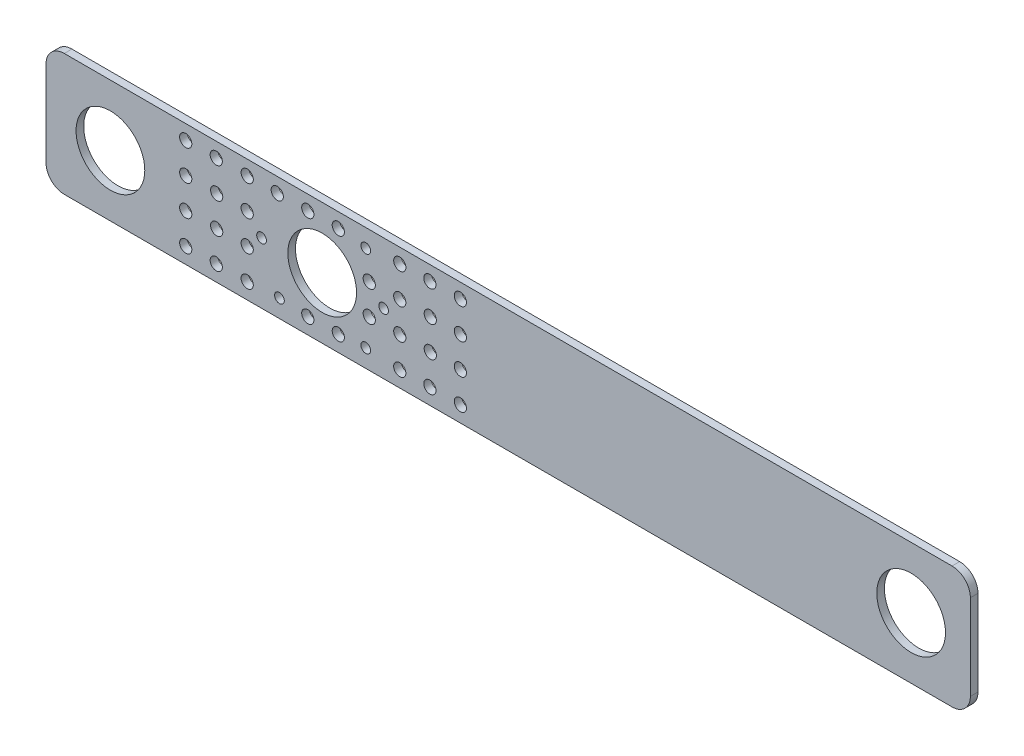
from build123d import *

# Parameters (mm, degrees)
SKETCH1_W           = 384.714130078
SKETCH1_H           = 50.8
SKETCH1_R           = 14.3002
SKETCH1_R_2         = 2.0193
SKETCH1_R_3         = 2.54
BOSS_EXTRUDE1_DEPTH = 3.175
FILLET1_R           = 7.62


with BuildPart() as part:
    # Sketch1 → Boss-Extrude1 (new body)
    with BuildSketch(Plane.XY):
        with Locations((91.437616825, 0.672961839)):
            Rectangle(SKETCH1_W, SKETCH1_H)
        with Locations((-74.109858368, 0.672961839)):
            Circle(SKETCH1_R, mode=Mode.SUBTRACT)
        with Locations((14.028141632, 0.672961839)):
            Circle(SKETCH1_R, mode=Mode.SUBTRACT)
        with Locations((259.138141632, 0.672961839)):
            Circle(SKETCH1_R, mode=Mode.SUBTRACT)
        with Locations((39.592109109, 0.662961839)):
            Circle(SKETCH1_R_2, mode=Mode.SUBTRACT)
        with Locations((32.152621351, -17.297550403)):
            Circle(SKETCH1_R_2, mode=Mode.SUBTRACT)
        with Locations((-3.768403133, -17.297550403)):
            Circle(SKETCH1_R_2, mode=Mode.SUBTRACT)
        with Locations((32.152621351, 18.623474081)):
            Circle(SKETCH1_R_2, mode=Mode.SUBTRACT)
        with Locations((-11.207890891, 0.662961839)):
            Circle(SKETCH1_R_2, mode=Mode.SUBTRACT)
        with Locations((-29.885519869, 7.289574438)):
            Circle(SKETCH1_R_3, mode=Mode.SUBTRACT)
        with Locations((-29.885519869, -5.410425562)):
            Circle(SKETCH1_R_3, mode=Mode.SUBTRACT)
        with Locations((-17.185519869, 7.289574438)):
            Circle(SKETCH1_R_3, mode=Mode.SUBTRACT)
        with Locations((-17.185519869, -5.410425562)):
            Circle(SKETCH1_R_3, mode=Mode.SUBTRACT)
        with Locations((-17.185519869, -18.110425562)):
            Circle(SKETCH1_R_3, mode=Mode.SUBTRACT)
        with Locations((-17.185519869, 19.989574438)):
            Circle(SKETCH1_R_3, mode=Mode.SUBTRACT)
        with Locations((-30.066807854, 19.989574438)):
            Circle(SKETCH1_R_3, mode=Mode.SUBTRACT)
        with Locations((33.614480131, -5.410425562)):
            Circle(SKETCH1_R_3, mode=Mode.SUBTRACT)
        with Locations((33.614480131, 7.289574438)):
            Circle(SKETCH1_R_3, mode=Mode.SUBTRACT)
        with Locations((59.014480131, -5.410425562)):
            Circle(SKETCH1_R_3, mode=Mode.SUBTRACT)
        with Locations((59.014480131, 7.289574438)):
            Circle(SKETCH1_R_3, mode=Mode.SUBTRACT)
        with Locations((46.314480131, 7.289574438)):
            Circle(SKETCH1_R_3, mode=Mode.SUBTRACT)
        with Locations((46.314480131, -5.410425562)):
            Circle(SKETCH1_R_3, mode=Mode.SUBTRACT)
        with Locations((46.314480131, -18.110425562)):
            Circle(SKETCH1_R_3, mode=Mode.SUBTRACT)
        with Locations((58.833192146, -18.110425562)):
            Circle(SKETCH1_R_3, mode=Mode.SUBTRACT)
        with Locations((71.533192146, -18.110425562)):
            Circle(SKETCH1_R_3, mode=Mode.SUBTRACT)
        with Locations((71.533192146, -5.410425562)):
            Circle(SKETCH1_R_3, mode=Mode.SUBTRACT)
        with Locations((71.533192146, 7.289574438)):
            Circle(SKETCH1_R_3, mode=Mode.SUBTRACT)
        with Locations((71.533192146, 19.989574438)):
            Circle(SKETCH1_R_3, mode=Mode.SUBTRACT)
        with Locations((58.833192146, 19.989574438)):
            Circle(SKETCH1_R_3, mode=Mode.SUBTRACT)
        with Locations((46.314480131, 19.989574438)):
            Circle(SKETCH1_R_3, mode=Mode.SUBTRACT)
        with Locations((20.733192146, 19.989574438)):
            Circle(SKETCH1_R_3, mode=Mode.SUBTRACT)
        with Locations((8.033192146, 19.989574438)):
            Circle(SKETCH1_R_3, mode=Mode.SUBTRACT)
        with Locations((-4.666807854, 19.989574438)):
            Circle(SKETCH1_R_3, mode=Mode.SUBTRACT)
        with Locations((20.733192146, -18.110425562)):
            Circle(SKETCH1_R_3, mode=Mode.SUBTRACT)
        with Locations((8.033192146, -18.110425562)):
            Circle(SKETCH1_R_3, mode=Mode.SUBTRACT)
        with Locations((-30.066807854, -18.110425562)):
            Circle(SKETCH1_R_3, mode=Mode.SUBTRACT)
        with Locations((-42.766807854, -18.110425562)):
            Circle(SKETCH1_R_3, mode=Mode.SUBTRACT)
        with Locations((-42.766807854, 19.989574438)):
            Circle(SKETCH1_R_3, mode=Mode.SUBTRACT)
        with Locations((-42.766807854, 7.289574438)):
            Circle(SKETCH1_R_3, mode=Mode.SUBTRACT)
        with Locations((-42.766807854, -5.410425562)):
            Circle(SKETCH1_R_3, mode=Mode.SUBTRACT)
    extrude(amount=BOSS_EXTRUDE1_DEPTH)

    # Fillet1
    fillet1_edges = [part.edges().sort_by_distance(p)[0] for p in [
        (283.794681864, -24.727038161, 1.5875),
        (283.794681864, 26.072961839, 1.5875),
        (-100.919448214, -24.727038161, 1.5875),
        (-100.919448214, 26.072961839, 1.5875),
    ]]
    fillet(fillet1_edges, radius=FILLET1_R)


solid = part.part
